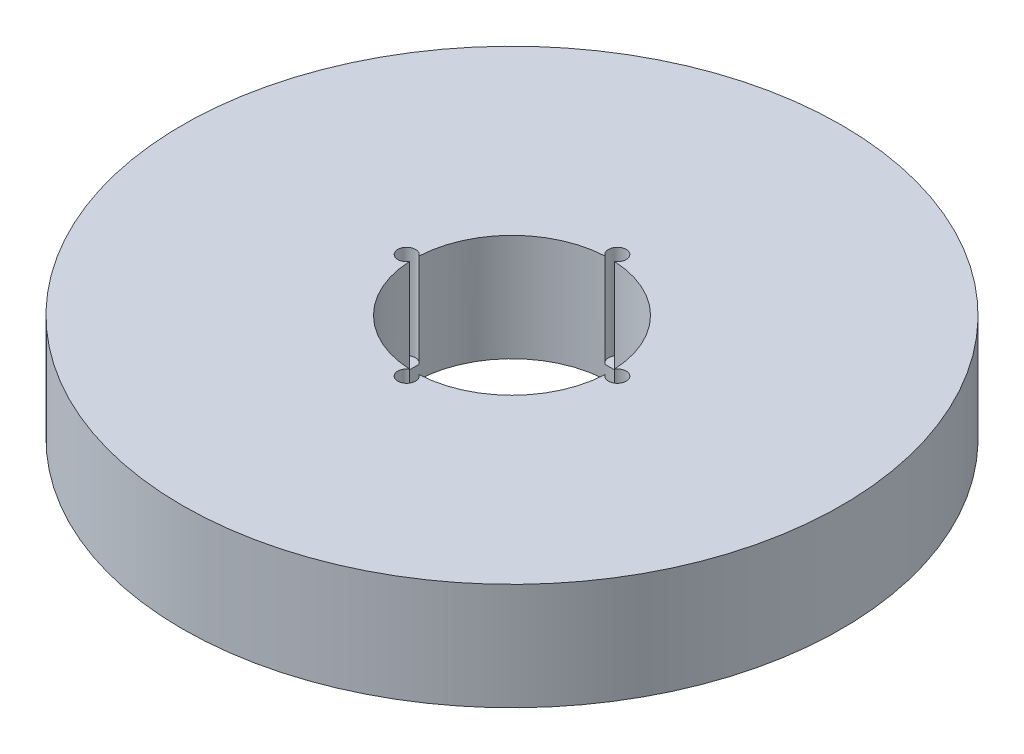
from build123d import *

# Parameters (mm, degrees)
SKETCH1_R           = 92.5
BOSS_EXTRUDE1_DEPTH = 30
SKETCH2_R           = 27.5
CUT_EXTRUDE1_DEPTH  = 135.210655315
SKETCH3_R           = 2.47776265
CUT_EXTRUDE2_DEPTH  = 26.360739339
CIRPATTERN1_COUNT   = 4


with BuildPart() as part:
    # Sketch1 → Boss-Extrude1 (new body)
    with BuildSketch(Plane(origin=(0, 0, 0), x_dir=(1, 0, 0), z_dir=(0, 1, 0))):
        Circle(SKETCH1_R)
    extrude(amount=BOSS_EXTRUDE1_DEPTH)

    # Sketch2 → Cut-Extrude1 (cut, through all)
    with BuildSketch(Plane(origin=(0, 0, 0), x_dir=(1, 0, 0), z_dir=(0, 1, 0))):
        Circle(SKETCH2_R)
    extrude(amount=CUT_EXTRUDE1_DEPTH, mode=Mode.SUBTRACT)

    # Sketch3 → Cut-Extrude2 (cut)
    with BuildSketch(Plane(origin=(0, 30, 0), x_dir=(1, 0, 0), z_dir=(0, 1, 0))):
        with Locations((-29.571959387, 0)):
            Circle(SKETCH3_R)
    cut_extrude2 = extrude(amount=-CUT_EXTRUDE2_DEPTH, mode=Mode.SUBTRACT)

    # CirPattern1: Cut-Extrude2 ×4 about axis
    cirpattern1_axis = Axis((0, 0, 0), (0, 1, 0))
    for i in range(1, CIRPATTERN1_COUNT):
        add(cut_extrude2.rotate(cirpattern1_axis, i * 360 / CIRPATTERN1_COUNT), mode=Mode.SUBTRACT)


solid = part.part
